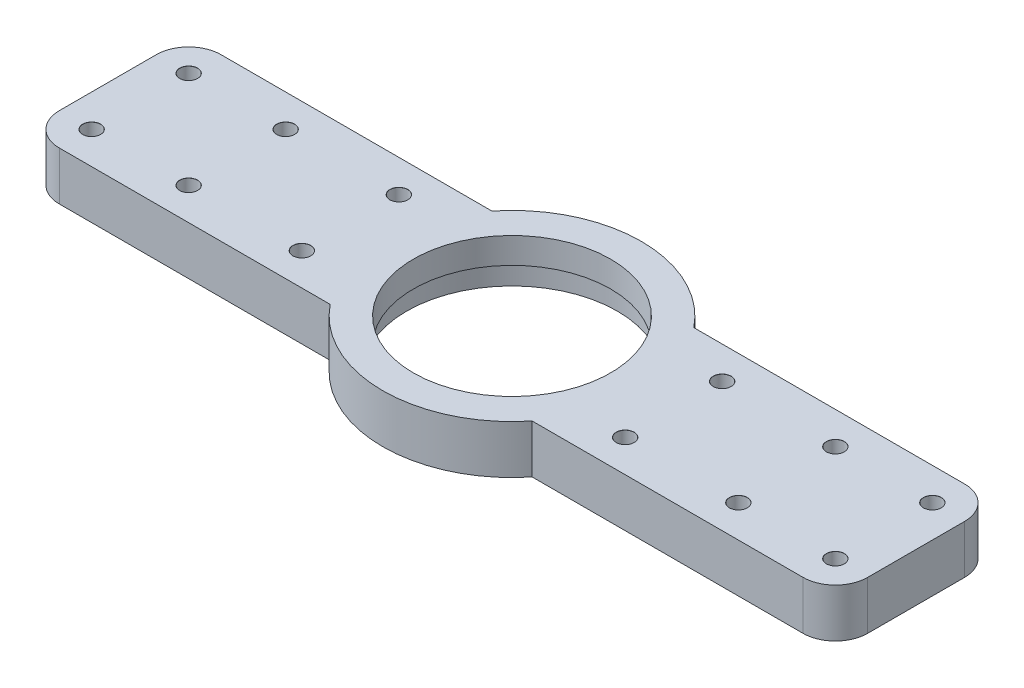
from build123d import *

# Parameters (mm, degrees)
BOSS_EXTRUDE1_DEPTH = 15
CUT_EXTRUDE3_REACH  = 134.098
SKETCH4_R           = 30.5
SKETCH3_R           = 32.6
CUT_EXTRUDE4_DEPTH  = 7
FILLET1_R           = 10


# Read off the part's stored shape, not the designer's step: M5 Clearance Hole1
with BuildPart() as part:
    # Sketch1 → Boss-Extrude1 (new body)
    with BuildSketch(Plane(origin=(0, 0, 0), x_dir=(1, 0, 0), z_dir=(0, 1, 0))):
        with BuildLine():
            ThreePointArc((31.224989992, 25), (0, 40), (-31.224989992, 25))
            Line((-31.224989992, 25), (31.224989992, 25))
        make_face()
        with BuildLine():
            Line((31.224989992, 25), (-31.224989992, 25))
            ThreePointArc((-31.224989992, 25), (-40, 0), (-31.224989992, -25))
            Line((-31.224989992, -25), (31.224989992, -25))
            ThreePointArc((31.224989992, -25), (37.742546282, -13.247648854), (40, 0))
            ThreePointArc((40, 0), (37.742546282, 13.247648854), (31.224989992, 25))
        make_face()
        with BuildLine():
            Line((-31.224989992, 25), (-125, 25))
            Line((-125, 25), (-125, -25))
            Line((-125, -25), (-31.224989992, -25))
            ThreePointArc((-31.224989992, -25), (-40, 0), (-31.224989992, 25))
        make_face()
        with BuildLine():
            Line((125, 25), (31.224989992, 25))
            ThreePointArc((31.224989992, 25), (37.742546282, 13.247648854), (40, 0))
            ThreePointArc((40, 0), (37.742546282, -13.247648854), (31.224989992, -25))
            Line((31.224989992, -25), (125, -25))
            Line((125, -25), (125, 25))
        make_face()
        with BuildLine():
            Line((31.224989992, -25), (-31.224989992, -25))
            ThreePointArc((-31.224989992, -25), (0, -40), (31.224989992, -25))
        make_face()
    extrude(amount=BOSS_EXTRUDE1_DEPTH)

    # Sketch4 → Cut-Extrude3 (cut, up to next)
    with BuildSketch(Plane(origin=(0, 15, 0), x_dir=(1, 0, 0), z_dir=(0, 1, 0)), mode=Mode.PRIVATE) as cut_extrude3_sk1:
        with Locations(Location((0, 0, 0), (0, 0, 270))):
            Circle(SKETCH4_R)
    cut_extrude3_tool1 = extrude(cut_extrude3_sk1.sketch, amount=-CUT_EXTRUDE3_REACH, mode=Mode.PRIVATE) & part.part
    add(cut_extrude3_tool1.solids().sort_by_distance((0, 15, 0))[0], mode=Mode.SUBTRACT)

    # Sketch3 → Cut-Extrude4 (cut)
    with BuildSketch(Plane.XZ):
        with Locations(Location((0, 0, 0), (0, 0, 270))):
            Circle(SKETCH3_R)
    extrude(amount=-CUT_EXTRUDE4_DEPTH, mode=Mode.SUBTRACT)

    # M5 Clearance Hole1 outline → M5 Clearance Hole1 (revolve, cut)
    with BuildSketch(Plane(origin=(-50, 0, 15), x_dir=(1, 0, 0), z_dir=(0, 0, 1))):
        Polygon((0, 0), (2.75, 0), (2.75, 14.975), (2.775, 15), (0, 15), align=None)
    revolve(axis=Axis((-50, 0, 15), (0, 1, 0)), mode=Mode.SUBTRACT)

    # M5 Clearance Hole1 2 outline → M5 Clearance Hole1 2 (revolve, cut)
    with BuildSketch(Plane(origin=(-50, 0, -15), x_dir=(1, 0, 0), z_dir=(0, 0, 1))):
        Polygon((0, 0), (2.75, 0), (2.75, 14.975), (2.775, 15), (0, 15), align=None)
    revolve(axis=Axis((-50, 0, -15), (0, 1, 0)), mode=Mode.SUBTRACT)

    # M5 Clearance Hole1 3 outline → M5 Clearance Hole1 3 (revolve, cut)
    with BuildSketch(Plane(origin=(50, 0, 15), x_dir=(1, 0, 0), z_dir=(0, 0, 1))):
        Polygon((0, 0), (2.75, 0), (2.75, 14.975), (2.775, 15), (0, 15), align=None)
    revolve(axis=Axis((50, 0, 15), (0, 1, 0)), mode=Mode.SUBTRACT)

    # M5 Clearance Hole1 4 outline → M5 Clearance Hole1 4 (revolve, cut)
    with BuildSketch(Plane(origin=(50, 0, -15), x_dir=(1, 0, 0), z_dir=(0, 0, 1))):
        Polygon((0, 0), (2.75, 0), (2.75, 14.975), (2.775, 15), (0, 15), align=None)
    revolve(axis=Axis((50, 0, -15), (0, 1, 0)), mode=Mode.SUBTRACT)

    # M5 Clearance Hole1 5 outline → M5 Clearance Hole1 5 (revolve, cut)
    with BuildSketch(Plane(origin=(115, 0, -15), x_dir=(1, 0, 0), z_dir=(0, 0, 1))):
        Polygon((0, 0), (2.75, 0), (2.75, 14.975), (2.775, 15), (0, 15), align=None)
    revolve(axis=Axis((115, 0, -15), (0, 1, 0)), mode=Mode.SUBTRACT)

    # M5 Clearance Hole1 6 outline → M5 Clearance Hole1 6 (revolve, cut)
    with BuildSketch(Plane(origin=(85, 0, 15), x_dir=(1, 0, 0), z_dir=(0, 0, 1))):
        Polygon((0, 0), (2.75, 0), (2.75, 14.975), (2.775, 15), (0, 15), align=None)
    revolve(axis=Axis((85, 0, 15), (0, 1, 0)), mode=Mode.SUBTRACT)

    # M5 Clearance Hole1 7 outline → M5 Clearance Hole1 7 (revolve, cut)
    with BuildSketch(Plane(origin=(115, 0, 15), x_dir=(1, 0, 0), z_dir=(0, 0, 1))):
        Polygon((0, 0), (2.75, 0), (2.75, 14.975), (2.775, 15), (0, 15), align=None)
    revolve(axis=Axis((115, 0, 15), (0, 1, 0)), mode=Mode.SUBTRACT)

    # M5 Clearance Hole1 8 outline → M5 Clearance Hole1 8 (revolve, cut)
    with BuildSketch(Plane(origin=(85, 0, -15), x_dir=(1, 0, 0), z_dir=(0, 0, 1))):
        Polygon((0, 0), (2.75, 0), (2.75, 14.975), (2.775, 15), (0, 15), align=None)
    revolve(axis=Axis((85, 0, -15), (0, 1, 0)), mode=Mode.SUBTRACT)

    # M5 Clearance Hole1 9 outline → M5 Clearance Hole1 9 (revolve, cut)
    with BuildSketch(Plane(origin=(-85, 0, -15), x_dir=(1, 0, 0), z_dir=(0, 0, 1))):
        Polygon((0, 0), (2.75, 0), (2.75, 14.975), (2.775, 15), (0, 15), align=None)
    revolve(axis=Axis((-85, 0, -15), (0, 1, 0)), mode=Mode.SUBTRACT)

    # M5 Clearance Hole1 10 outline → M5 Clearance Hole1 10 (revolve, cut)
    with BuildSketch(Plane(origin=(-115, 0, 15), x_dir=(1, 0, 0), z_dir=(0, 0, 1))):
        Polygon((0, 0), (2.75, 0), (2.75, 14.975), (2.775, 15), (0, 15), align=None)
    revolve(axis=Axis((-115, 0, 15), (0, 1, 0)), mode=Mode.SUBTRACT)

    # M5 Clearance Hole1 11 outline → M5 Clearance Hole1 11 (revolve, cut)
    with BuildSketch(Plane(origin=(-85, 0, 15), x_dir=(1, 0, 0), z_dir=(0, 0, 1))):
        Polygon((0, 0), (2.75, 0), (2.75, 14.975), (2.775, 15), (0, 15), align=None)
    revolve(axis=Axis((-85, 0, 15), (0, 1, 0)), mode=Mode.SUBTRACT)

    # M5 Clearance Hole1 12 outline → M5 Clearance Hole1 12 (revolve, cut)
    with BuildSketch(Plane(origin=(-115, 0, -15), x_dir=(1, 0, 0), z_dir=(0, 0, 1))):
        Polygon((0, 0), (2.75, 0), (2.75, 14.975), (2.775, 15), (0, 15), align=None)
    revolve(axis=Axis((-115, 0, -15), (0, 1, 0)), mode=Mode.SUBTRACT)

    # Fillet1
    fillet1_edges = [part.edges().sort_by_distance(p)[0] for p in [
        (125, 7.5, -25),
        (125, 7.5, 25),
        (-125, 7.5, 25),
        (-125, 7.5, -25),
    ]]
    fillet(fillet1_edges, radius=FILLET1_R)


solid = part.part
